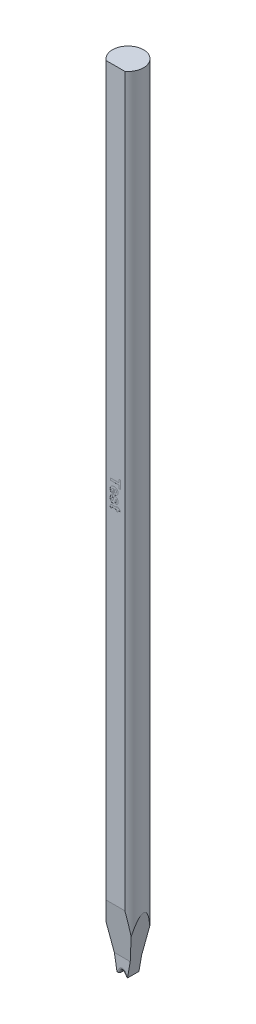
from build123d import *

# Parameters (mm, degrees)
SKETCH_TL_CUTTING_R       = 1.4986
TL_CUTTING_DEPTH          = 75.9968
SKETCH_TDF_GRINDING_W     = 3.0172
SKETCH_TDF_GRINDING_H     = 3.0172
TDF_GRINDING_DEPTH        = 77.026345527
ENGRAVING_DEPTH           = 0.005
VW_VR_GRINDING_DEPTH      = 1.5086
VW_VR_GRINDING_DEPTH_BACK = 1.5086
ISA_GRINDING_DEPTH        = 1.5086
ISA_GRINDING_DEPTH_BACK   = 1.5086
PRE_FRX_BRX_DEPTH         = 1.5086
PRE_FRX_BRX_DEPTH_BACK    = 1.5086
SKETCH_PRE_FRX_BRX_W      = 0.95742
SKETCH_PRE_FRX_BRX_H      = 1.4986
SKETCH_PRE_FRX_BRX_W_2    = 0.95996
FR_EDM_R                  = 0.24892
BR_EDM_R                  = 0.24892
FA_BA_GRINDING_DEPTH      = 1.5086
FA_BA_GRINDING_DEPTH_BACK = 1.5086


with BuildPart() as part:
    # sketch_TL_cutting → TL_cutting (new body)
    with BuildSketch(Plane(origin=(0, 0, 0), x_dir=(1, 0, 0), z_dir=(0, 1, 0))):
        Circle(SKETCH_TL_CUTTING_R)
    extrude(amount=TL_CUTTING_DEPTH)

    # sketch_TDF_grinding → TDF_grinding (cut, through all)
    with BuildSketch(Plane(origin=(0, 0, 0), x_dir=(1, 0, 0), z_dir=(0, 1, 0))):
        with Locations((0, -2.71002)):
            Rectangle(SKETCH_TDF_GRINDING_W, SKETCH_TDF_GRINDING_H)
    extrude(amount=TDF_GRINDING_DEPTH, mode=Mode.SUBTRACT)

    # sketch_engraving → engraving (cut)
    # profile 1 of 4: a face of its own
    with BuildSketch(Plane.XY.offset(1.20142)):
        Polygon((-0.5, 41.464906667), (0.333333333, 41.464906667), (0.333333333, 41.759778462), (0.5, 41.759778462), (0.5, 40.977727179), (0.333333333, 40.977727179), (0.333333333, 41.272598974), (-0.5, 41.272598974), align=None)
    # profile 2 of 4: a face of its own
    with BuildSketch(Plane.XY.offset(1.20142)):
        with BuildLine():
            Line((-0.269230769, 40.439265641), (-0.294871795, 40.246957949))
            add(Edge.make_bspline(
                [(-0.294871795, 40.246957949), (-0.303536255, 40.25010341), (-0.32057243, 40.256288057), (-0.344863965, 40.267587447), (-0.36753558, 40.280217941), (-0.38870841, 40.294118818), (-0.40841008, 40.309238344), (-0.426226149, 40.326076464), (-0.442819851, 40.343812903), (-0.457401048, 40.363189569), (-0.470514378, 40.383720953), (-0.481988402, 40.405510233), (-0.491332973, 40.428731665), (-0.499158418, 40.4530336), (-0.505404699, 40.478526347), (-0.509771463, 40.505313912), (-0.51242458, 40.533361927), (-0.512686872, 40.552507543), (-0.512820513, 40.562262436)],
                knots=[0, 0, 0, 0, 1.071172907, 2.106154283, 3.1104349, 4.085737425, 5.048416355, 5.993087888, 6.932482331, 7.868664062, 8.80754521, 9.762367971, 10.726735429, 11.713584758, 12.728370439, 13.774815933, 14.866245336, 16, 16, 16, 16], degree=3))
            add(Edge.make_bspline(
                [(-0.512820513, 40.562262436), (-0.512443282, 40.577505689), (-0.51171073, 40.607106927), (-0.505852845, 40.649939619), (-0.496231539, 40.689758957), (-0.482996444, 40.726630518), (-0.465262586, 40.760258048), (-0.443980436, 40.790893584), (-0.418772334, 40.818567377), (-0.399264925, 40.834082304), (-0.389423077, 40.841909872)],
                knots=[0, 0, 0, 0, 1.15090686, 2.234973544, 3.257507168, 4.240282073, 5.185422152, 6.119941203, 7.051475585, 8, 8, 8, 8], degree=3))
            add(Edge.make_bspline(
                [(-0.389423077, 40.841909872), (-0.381046549, 40.847684615), (-0.364178666, 40.859313262), (-0.336856894, 40.873798975), (-0.307933811, 40.886068192), (-0.277558503, 40.896316223), (-0.245440266, 40.904091085), (-0.211772448, 40.909713673), (-0.176408554, 40.912856462), (-0.152316287, 40.9133651), (-0.140024038, 40.913624615)],
                knots=[0, 0, 0, 0, 0.924739034, 1.862154457, 2.806332648, 3.78003102, 4.774289357, 5.808656063, 6.881942244, 8, 8, 8, 8], degree=3))
            add(Edge.make_bspline(
                [(-0.140024038, 40.913624615), (-0.125455951, 40.913382004), (-0.096984123, 40.912907846), (-0.055513373, 40.908444498), (-0.016425807, 40.901108358), (0.020119322, 40.890700859), (0.054294407, 40.87742375), (0.086062076, 40.86124031), (0.115338437, 40.841856538), (0.141890673, 40.819628649), (0.165678093, 40.795179773), (0.186654734, 40.769191172), (0.204171816, 40.741432799), (0.218793413, 40.712327282), (0.22973775, 40.681387916), (0.237794287, 40.649002574), (0.242700593, 40.615029484), (0.243290251, 40.591859286), (0.243589744, 40.580090962)],
                knots=[0, 0, 0, 0, 1.22208028, 2.38843015, 3.495001974, 4.555551, 5.572102979, 6.566928721, 7.541284444, 8.51191166, 9.466805643, 10.399597494, 11.308905182, 12.215983304, 13.126946664, 14.056451325, 15.012856426, 16, 16, 16, 16], degree=3))
            add(Edge.make_bspline(
                [(0.243589744, 40.580090962), (0.243311261, 40.566919824), (0.242766301, 40.541145288), (0.237650471, 40.503565991), (0.229328986, 40.468085107), (0.217373094, 40.434816508), (0.202375393, 40.40355058), (0.183809309, 40.37449302), (0.161721866, 40.34770694), (0.136526927, 40.322947507), (0.107657568, 40.301021168), (0.075306929, 40.282081461), (0.039386169, 40.266291438), (-6.4395e-05, 40.25346711), (-0.043155579, 40.243992551), (-0.089766999, 40.237507904), (-0.139896801, 40.233810273), (-0.174473137, 40.234026108), (-0.192307692, 40.234137436)],
                knots=[0, 0, 0, 0, 0.994914541, 1.946943474, 2.860007193, 3.744253739, 4.613162343, 5.475451996, 6.343187588, 7.231728884, 8.139057486, 9.075471918, 10.058180036, 11.098621179, 12.205332334, 13.387827392, 14.65263521, 16, 16, 16, 16], degree=3))
            Line((-0.192307692, 40.234137436), (-0.192307692, 40.721316923))
            add(Edge.make_bspline(
                [(-0.192307692, 40.721316923), (-0.199190121, 40.720999192), (-0.212592416, 40.720380467), (-0.232195578, 40.718086627), (-0.250479259, 40.713947909), (-0.267812634, 40.709078971), (-0.283741268, 40.70243089), (-0.298585088, 40.694544096), (-0.312263908, 40.685333492), (-0.324637591, 40.674722151), (-0.335614883, 40.66309259), (-0.345276708, 40.650829783), (-0.353640982, 40.6379697), (-0.360224098, 40.624195392), (-0.365494916, 40.609790027), (-0.36902659, 40.59464782), (-0.371322908, 40.578892139), (-0.371635397, 40.568146811), (-0.371794872, 40.562663077)],
                knots=[0, 0, 0, 0, 1.231638706, 2.398395625, 3.522289669, 4.579947828, 5.613000372, 6.600997726, 7.58103015, 8.554716894, 9.508889492, 10.435482506, 11.342805004, 12.245087657, 13.158904806, 14.079635201, 15.019967576, 16, 16, 16, 16], degree=3))
            add(Edge.make_bspline(
                [(-0.371794872, 40.562663077), (-0.37147122, 40.555363831), (-0.370844355, 40.541226282), (-0.366452232, 40.520847955), (-0.358712143, 40.502358041), (-0.34792154, 40.485562797), (-0.333591606, 40.470618375), (-0.315339539, 40.458089025), (-0.293735149, 40.447134255), (-0.277667648, 40.441974811), (-0.269230769, 40.439265641)],
                knots=[0, 0, 0, 0, 1.004430367, 1.945431754, 2.851730883, 3.749038912, 4.678525969, 5.68064125, 6.782128749, 8, 8, 8, 8], degree=3))
        make_face()
        with BuildLine():
            add(Edge.make_bspline(
                [(-0.076923077, 40.426445128), (-0.0698403, 40.426773639), (-0.056046098, 40.427413437), (-0.035946701, 40.429550056), (-0.017148581, 40.433043965), (0.000200148, 40.438199045), (0.016332408, 40.444147578), (0.031252693, 40.451307474), (0.044751188, 40.459955927), (0.056718236, 40.469898372), (0.067663617, 40.48037548), (0.076749299, 40.491967324), (0.084970517, 40.503707813), (0.091312261, 40.516239906), (0.09644632, 40.529225061), (0.100044461, 40.542799996), (0.102017666, 40.556996733), (0.102379943, 40.566596988), (0.102564103, 40.571477179)],
                knots=[0, 0, 0, 0, 1.317155349, 2.565252013, 3.752617023, 4.863710936, 5.923691592, 6.944619286, 7.932291025, 8.893346204, 9.832040666, 10.740742434, 11.625065814, 12.490654946, 13.343074709, 14.215747339, 15.092993572, 16, 16, 16, 16], degree=3))
            add(Edge.make_bspline(
                [(0.102564103, 40.571477179), (0.102394824, 40.576692132), (0.102061251, 40.586968456), (0.099884751, 40.602038379), (0.096024349, 40.616322459), (0.09079949, 40.629929555), (0.083918898, 40.642830507), (0.0754807, 40.655025603), (0.065590542, 40.666560723), (0.058097667, 40.673511161), (0.054286859, 40.67704609)],
                knots=[0, 0, 0, 0, 1.043516863, 2.056302107, 3.038302912, 3.998520634, 4.966791607, 5.956307719, 6.960596886, 8, 8, 8, 8], degree=3))
            add(Edge.make_bspline(
                [(0.054286859, 40.67704609), (0.050143389, 40.680339206), (0.04181864, 40.686955486), (0.028026538, 40.695376823), (0.013220128, 40.702598805), (-0.002752654, 40.708441047), (-0.019802657, 40.712817844), (-0.037911914, 40.715738646), (-0.057052364, 40.717597277), (-0.070174406, 40.717804764), (-0.076923077, 40.717911474)],
                knots=[0, 0, 0, 0, 0.903766344, 1.81577923, 2.754803886, 3.715080786, 4.716965023, 5.758108642, 6.846994466, 8, 8, 8, 8], degree=3))
            Line((-0.076923077, 40.717911474), (-0.076923077, 40.426445128))
        make_face(mode=Mode.SUBTRACT)
    # profile 3 of 4: a face of its own
    with BuildSketch(Plane.XY.offset(1.20142)):
        with BuildLine():
            Line((-0.282051282, 40.157214359), (-0.256410256, 39.964906667))
            add(Edge.make_bspline(
                [(-0.256410256, 39.964906667), (-0.265392316, 39.962598786), (-0.282694005, 39.958153233), (-0.306215409, 39.946892879), (-0.326584524, 39.932776729), (-0.343301626, 39.914989528), (-0.356462242, 39.89364559), (-0.365240358, 39.868427989), (-0.37099337, 39.839698413), (-0.37151826, 39.81923851), (-0.371794872, 39.808456346)],
                knots=[0, 0, 0, 0, 1.039319445, 2.001988807, 2.911187514, 3.807680854, 4.723381073, 5.705509029, 6.790826147, 8, 8, 8, 8], degree=3))
            add(Edge.make_bspline(
                [(-0.371794872, 39.808456346), (-0.371595476, 39.7966699), (-0.371221553, 39.774567061), (-0.365704055, 39.74385632), (-0.358276706, 39.717120835), (-0.349217718, 39.702405088), (-0.344951923, 39.695475577)],
                knots=[0, 0, 0, 0, 1.198484229, 2.247488828, 3.174758401, 4, 4, 4, 4], degree=3))
            add(Edge.make_bspline(
                [(-0.344951923, 39.695475577), (-0.341742613, 39.691522291), (-0.33550118, 39.683833982), (-0.322943507, 39.676031952), (-0.309159996, 39.670838698), (-0.299329041, 39.670307951), (-0.294270833, 39.670034872)],
                knots=[0, 0, 0, 0, 1.030872991, 2.004830756, 2.973448591, 4, 4, 4, 4], degree=3))
            add(Edge.make_bspline(
                [(-0.294270833, 39.670034872), (-0.29084777, 39.670165774), (-0.284161693, 39.670421458), (-0.274600311, 39.673096895), (-0.265958556, 39.677587368), (-0.261079044, 39.681752599), (-0.258613782, 39.683856987)],
                knots=[0, 0, 0, 0, 1.045349703, 2.041822997, 3.010676005, 4, 4, 4, 4], degree=3))
            add(Edge.make_bspline(
                [(-0.258613782, 39.683856987), (-0.256288912, 39.686922785), (-0.250848162, 39.694097485), (-0.244943535, 39.708429431), (-0.238900398, 39.726835958), (-0.235595409, 39.740712737), (-0.233774038, 39.748360192)],
                knots=[0, 0, 0, 0, 0.66039037, 1.545471194, 2.647315926, 4, 4, 4, 4], degree=3))
            add(Edge.make_bspline(
                [(-0.233774038, 39.748360192), (-0.229705714, 39.767006174), (-0.22194668, 39.802567449), (-0.209757361, 39.853068792), (-0.19774553, 39.898138274), (-0.186203797, 39.937925975), (-0.174918001, 39.972396417), (-0.163759522, 40.001503265), (-0.153049809, 40.025369784), (-0.144879526, 40.038819946), (-0.141225962, 40.044834551)],
                knots=[0, 0, 0, 0, 1.469060602, 2.801765397, 3.998694248, 5.05919304, 5.990566457, 6.789528243, 7.45870461, 8, 8, 8, 8], degree=3))
            add(Edge.make_bspline(
                [(-0.141225962, 40.044834551), (-0.136226873, 40.051692589), (-0.126466322, 40.065082676), (-0.109659896, 40.082918181), (-0.091386741, 40.098041367), (-0.071590355, 40.110406522), (-0.050318141, 40.119844447), (-0.027668833, 40.12674572), (-0.003546555, 40.130742085), (0.013006297, 40.131292888), (0.021434295, 40.131573333)],
                knots=[0, 0, 0, 0, 1.056974227, 2.063706289, 3.045111424, 4.005796011, 4.963194591, 5.937303459, 6.949763919, 8, 8, 8, 8], degree=3))
            add(Edge.make_bspline(
                [(0.021434295, 40.131573333), (0.029124721, 40.131328093), (0.04431443, 40.130843707), (0.06658025, 40.127437557), (0.08788195, 40.121558829), (0.108244702, 40.113277356), (0.127669101, 40.102661186), (0.146109736, 40.089645985), (0.163499189, 40.07434958), (0.18008332, 40.056885441), (0.195101302, 40.036850205), (0.208193344, 40.014188789), (0.219189739, 39.988972252), (0.228160641, 39.961181932), (0.235116926, 39.930812892), (0.240034197, 39.897864691), (0.243059894, 39.862399271), (0.243409494, 39.837909752), (0.243589744, 39.825283269)],
                knots=[0, 0, 0, 0, 0.866628782, 1.711717909, 2.531497577, 3.35182975, 4.18367977, 5.02092497, 5.890294189, 6.790012725, 7.730721042, 8.705258537, 9.733001209, 10.825364086, 11.991866675, 13.2403337, 14.577151382, 16, 16, 16, 16], degree=3))
            add(Edge.make_bspline(
                [(0.243589744, 39.825283269), (0.243446899, 39.813259386), (0.243169634, 39.789920784), (0.240731219, 39.756155029), (0.236899188, 39.724737838), (0.230948561, 39.695813753), (0.223974046, 39.669047243), (0.214898634, 39.644830721), (0.204526083, 39.622833073), (0.19215876, 39.603347891), (0.178364946, 39.585602816), (0.162861914, 39.569633528), (0.145977964, 39.554950901), (0.127601745, 39.541585817), (0.107595464, 39.529812221), (0.085933763, 39.519636763), (0.062896123, 39.510489482), (0.046718542, 39.505774647), (0.038461538, 39.503368205)],
                knots=[0, 0, 0, 0, 1.38031105, 2.679211982, 3.884975083, 5.011116117, 6.067453267, 7.057174624, 7.976132094, 8.854607518, 9.701157373, 10.55241532, 11.405604341, 12.267429654, 13.157569633, 14.066300783, 15.01304394, 16, 16, 16, 16], degree=3))
            Line((0.038461538, 39.503368205), (0.012820513, 39.695675897))
            add(Edge.make_bspline(
                [(0.012820513, 39.695675897), (0.019716836, 39.697580158), (0.033104434, 39.701276834), (0.051141649, 39.710461289), (0.066892754, 39.721619959), (0.079947134, 39.735527254), (0.090451531, 39.752318536), (0.097449696, 39.772358362), (0.101956518, 39.795301397), (0.102353946, 39.811637086), (0.102564103, 39.820275256)],
                knots=[0, 0, 0, 0, 1.018112573, 1.976427386, 2.86989064, 3.759232895, 4.678909429, 5.673224298, 6.76962116, 8, 8, 8, 8], degree=3))
            add(Edge.make_bspline(
                [(0.102564103, 39.820275256), (0.102424935, 39.830982738), (0.102166286, 39.850883004), (0.098045863, 39.878167454), (0.092323932, 39.901157567), (0.085068416, 39.913538276), (0.081730769, 39.91923359)],
                knots=[0, 0, 0, 0, 1.252081424, 2.327041614, 3.230413832, 4, 4, 4, 4], degree=3))
            add(Edge.make_bspline(
                [(0.081730769, 39.91923359), (0.079197183, 39.922315647), (0.074335374, 39.92822994), (0.064913663, 39.934615197), (0.054472552, 39.938670868), (0.047046059, 39.939065133), (0.043269231, 39.939265641)],
                knots=[0, 0, 0, 0, 1.057832138, 2.029920023, 2.998093444, 4, 4, 4, 4], degree=3))
            add(Edge.make_bspline(
                [(0.043269231, 39.939265641), (0.040033897, 39.939021951), (0.033581253, 39.938535928), (0.024317894, 39.934949065), (0.015848023, 39.928959869), (0.011363278, 39.923496983), (0.009014423, 39.920635833)],
                knots=[0, 0, 0, 0, 0.958252903, 1.911167308, 2.905987877, 4, 4, 4, 4], degree=3))
            add(Edge.make_bspline(
                [(0.009014423, 39.920635833), (0.007272068, 39.917937565), (0.003109312, 39.911490986), (-0.001987057, 39.899028151), (-0.007675168, 39.882869504), (-0.014111167, 39.86289725), (-0.021107365, 39.839067407), (-0.028443749, 39.811261341), (-0.036209836, 39.779579843), (-0.044306367, 39.745132427), (-0.052630208, 39.710146792), (-0.061887965, 39.676931001), (-0.071549097, 39.646529038), (-0.082070854, 39.618979873), (-0.092726589, 39.594156602), (-0.103967718, 39.572171411), (-0.115635077, 39.552916043), (-0.124552329, 39.541748363), (-0.12880609, 39.53642109)],
                knots=[0, 0, 0, 0, 0.374467347, 0.894660112, 1.565561736, 2.376893081, 3.344161852, 4.465830414, 5.734896654, 7.153471884, 8.598442955, 9.934182422, 11.179548312, 12.322244199, 13.376910086, 14.332509539, 15.204563813, 16, 16, 16, 16], degree=3))
            add(Edge.make_bspline(
                [(-0.12880609, 39.53642109), (-0.133161207, 39.531687939), (-0.141766598, 39.522335582), (-0.156708359, 39.510557826), (-0.172517892, 39.500117029), (-0.189865737, 39.492033237), (-0.208297358, 39.485514129), (-0.22803715, 39.480894372), (-0.249067342, 39.478389915), (-0.263482048, 39.477951013), (-0.270833333, 39.477727179)],
                knots=[0, 0, 0, 0, 0.971012965, 1.9186502, 2.868006896, 3.82989672, 4.803792202, 5.820095146, 6.888280979, 8, 8, 8, 8], degree=3))
            add(Edge.make_bspline(
                [(-0.270833333, 39.477727179), (-0.278992426, 39.478025435), (-0.295065709, 39.478612994), (-0.31877832, 39.482420371), (-0.34148056, 39.48919885), (-0.363516332, 39.498118098), (-0.384457432, 39.510155706), (-0.404505714, 39.524688777), (-0.423895683, 39.541581114), (-0.442088641, 39.561200642), (-0.458702848, 39.583469566), (-0.473419718, 39.608176937), (-0.485630501, 39.635506147), (-0.495629007, 39.665301312), (-0.503343888, 39.697625073), (-0.50897222, 39.7324343), (-0.51206406, 39.769738424), (-0.512563429, 39.795430104), (-0.512820513, 39.808656667)],
                knots=[0, 0, 0, 0, 0.853005228, 1.680406763, 2.502135431, 3.325285981, 4.159928718, 5.020072903, 5.910500533, 6.844018396, 7.811498054, 8.809909951, 9.84399402, 10.934451331, 12.090792638, 13.314110396, 14.617253208, 16, 16, 16, 16], degree=3))
            add(Edge.make_bspline(
                [(-0.512820513, 39.808656667), (-0.512612848, 39.82074682), (-0.51220841, 39.84429301), (-0.509517578, 39.878649126), (-0.504407099, 39.911008929), (-0.497724819, 39.941430888), (-0.489040825, 39.969973279), (-0.478560901, 39.996595401), (-0.465826863, 40.021265098), (-0.451129931, 40.04390131), (-0.434940139, 40.064778229), (-0.417179349, 40.083690578), (-0.398157879, 40.100828513), (-0.377590042, 40.115822075), (-0.355813358, 40.129219627), (-0.332587631, 40.140558496), (-0.307935086, 40.150141386), (-0.290780182, 40.154829112), (-0.282051282, 40.157214359)],
                knots=[0, 0, 0, 0, 1.27602789, 2.485129288, 3.633323873, 4.730967468, 5.769800648, 6.778755409, 7.74637841, 8.694428407, 9.62340196, 10.530821678, 11.429165597, 12.321379864, 13.213343615, 14.124177522, 15.045528489, 16, 16, 16, 16], degree=3))
        make_face()
    # profile 4 of 4: a face of its own
    with BuildSketch(Plane.XY.offset(1.20142)):
        with BuildLine():
            Line((0.230769231, 38.964906667), (0.08974359, 38.964906667))
            Line((0.08974359, 38.964906667), (0.08974359, 39.105932308))
            Line((0.08974359, 39.105932308), (-0.224358974, 39.105932308))
            add(Edge.make_bspline(
                [(-0.224358974, 39.105932308), (-0.231904339, 39.105945556), (-0.246127351, 39.10597053), (-0.266228543, 39.105806237), (-0.283853768, 39.105325979), (-0.299018236, 39.105043629), (-0.311701045, 39.104364066), (-0.321861303, 39.103856773), (-0.329566697, 39.103134169), (-0.338907815, 39.101406455), (-0.35057578, 39.096378956), (-0.360389431, 39.086711483), (-0.366182432, 39.077189126), (-0.369474906, 39.069160251), (-0.371514578, 39.060361013), (-0.371700117, 39.05419399), (-0.371794872, 39.051044487)],
                knots=[0, 0, 0, 0, 1.773599637, 3.343235314, 4.724802322, 5.918078765, 6.908020279, 7.709878159, 8.309605123, 8.725167438, 9.94114383, 11.228754835, 11.890951744, 12.552590386, 13.260806876, 14, 14, 14, 14], degree=3))
            add(Edge.make_bspline(
                [(-0.371794872, 39.051044487), (-0.371507964, 39.045889495), (-0.37087716, 39.034555574), (-0.367095421, 39.016080849), (-0.361305779, 38.994622787), (-0.356131124, 38.979434648), (-0.353365385, 38.971316923)],
                knots=[0, 0, 0, 0, 0.75345353, 1.656565626, 2.747486109, 4, 4, 4, 4], degree=3))
            Line((-0.353365385, 38.971316923), (-0.487379808, 38.952086154))
            add(Edge.make_bspline(
                [(-0.487379808, 38.952086154), (-0.491390152, 38.963763487), (-0.499569528, 38.98758022), (-0.506906498, 39.025434946), (-0.512003384, 39.065327386), (-0.512543433, 39.092693162), (-0.512820513, 39.10673359)],
                knots=[0, 0, 0, 0, 0.939563481, 1.916305015, 2.930928536, 4, 4, 4, 4], degree=3))
            add(Edge.make_bspline(
                [(-0.512820513, 39.10673359), (-0.512564303, 39.115356227), (-0.512063975, 39.132194556), (-0.50889268, 39.156851395), (-0.50326966, 39.180140275), (-0.495519476, 39.201893835), (-0.485995694, 39.221539445), (-0.475305475, 39.238842282), (-0.462868601, 39.253035517), (-0.449141562, 39.264891308), (-0.433202705, 39.274242612), (-0.415065056, 39.281666561), (-0.394648734, 39.288046812), (-0.380046946, 39.290660521), (-0.372395833, 39.292030064)],
                knots=[0, 0, 0, 0, 1.203015215, 2.349253984, 3.460901624, 4.539344044, 5.564274864, 6.502382232, 7.367332183, 8.186789841, 9.022345106, 9.932420497, 10.916620053, 12, 12, 12, 12], degree=3))
            add(Edge.make_bspline(
                [(-0.372395833, 39.292030064), (-0.369192653, 39.292510274), (-0.362066116, 39.293578659), (-0.35025766, 39.295028229), (-0.336212257, 39.295922671), (-0.319980191, 39.296655635), (-0.301558032, 39.297595843), (-0.280981809, 39.297794627), (-0.258215711, 39.298369957), (-0.242321525, 39.298284749), (-0.233974359, 39.29824)],
                knots=[0, 0, 0, 0, 0.560521704, 1.24706641, 2.057998689, 2.995119087, 4.059211621, 5.249632546, 6.555586685, 8, 8, 8, 8], degree=3))
            Line((-0.233974359, 39.29824), (0.08974359, 39.29824))
            Line((0.08974359, 39.29824), (0.08974359, 39.38798359))
            Line((0.08974359, 39.38798359), (0.230769231, 39.38798359))
            Line((0.230769231, 39.38798359), (0.230769231, 39.29824))
            Line((0.230769231, 39.29824), (0.371794872, 39.29824))
            Line((0.371794872, 39.29824), (0.487179487, 39.105932308))
            Line((0.487179487, 39.105932308), (0.230769231, 39.105932308))
            Line((0.230769231, 39.105932308), (0.230769231, 38.964906667))
        make_face()
    extrude(amount=-ENGRAVING_DEPTH, mode=Mode.SUBTRACT)

    # sketch_VW_VR_grinding → VW_VR_grinding (cut, two sides: drawn at the far end of the back side and taken through both)
    with BuildSketch(Plane.XY.offset(-VW_VR_GRINDING_DEPTH_BACK)):
        with BuildLine():
            Line((-1.4936, -0.01), (-1.4936, 1.4836))
            ThreePointArc((-1.4936, 1.4836), (-1.495064466, 1.487135534), (-1.4986, 1.4886))
            Line((-1.4986, 1.4886), (-1.5086, 1.4886))
            Line((-1.5086, 1.4886), (-1.5086, -0.01))
            Line((-1.5086, -0.01), (-1.4936, -0.01))
        make_face()
        with BuildLine():
            Line((1.4936, -0.01), (1.4936, 1.4836))
            ThreePointArc((1.4936, 1.4836), (1.495064466, 1.487135534), (1.4986, 1.4886))
            Line((1.4986, 1.4886), (1.5086, 1.4886))
            Line((1.5086, 1.4886), (1.5086, -0.01))
            Line((1.5086, -0.01), (1.4936, -0.01))
        make_face()
    extrude(amount=VW_VR_GRINDING_DEPTH + VW_VR_GRINDING_DEPTH_BACK, mode=Mode.SUBTRACT)

    # sketch_ISA_grinding → ISA_grinding (cut, two sides: drawn at the far end of the back side and taken through both)
    with BuildSketch(Plane.XY.offset(-ISA_GRINDING_DEPTH_BACK)):
        Polygon((-0.50038, 0), (-1.5086, 5.717899756), (-1.5086, -0.01), (1.5086, -0.01), (1.5086, 5.717899756), (0.50038, 0), align=None)
    extrude(amount=ISA_GRINDING_DEPTH + ISA_GRINDING_DEPTH_BACK, mode=Mode.SUBTRACT)

    # sketch_pre_FRX_BRX → pre_FRX_BRX (cut, two sides: drawn at the far end of the back side and taken through both)
    with BuildSketch(Plane(origin=(0, 0, 0), x_dir=(0, 0, -1), z_dir=(1, 0, 0)).offset(-PRE_FRX_BRX_DEPTH_BACK)):
        with Locations((-1.02989, 0.7393)):
            Rectangle(SKETCH_PRE_FRX_BRX_W, SKETCH_PRE_FRX_BRX_H)
        with Locations((1.02862, 0.7393)):
            Rectangle(SKETCH_PRE_FRX_BRX_W_2, SKETCH_PRE_FRX_BRX_H)
    extrude(amount=PRE_FRX_BRX_DEPTH + PRE_FRX_BRX_DEPTH_BACK, mode=Mode.SUBTRACT)

    # V-Groove_EDM: sweep along a path in sketch_contour_V-Groove
    with BuildLine(Plane(origin=(0, 0, 0), x_dir=(0, 0, -1), z_dir=(1, 0, 0))) as v_groove_edm_path:
        Line((-1.20142, 0.32004), (-0.00127, 0.32004))
        Line((-0.00127, 0.32004), (1.4986, 0.32004))
    # sketch_section_V-Groove → V-Groove_EDM (sweep, cut)
    with BuildSketch(Plane.XY.offset(1.20142)):
        with BuildLine():
            Line((-2.516534205, -3.2004), (-0.08103223, 0.277857291))
            ThreePointArc((-0.08103223, 0.277857291), (0, 0.32004), (0.08103223, 0.277857291))
            Line((0.08103223, 0.277857291), (2.516534205, -3.2004))
            Line((2.516534205, -3.2004), (-2.516534205, -3.2004))
        make_face()
    sweep(path=v_groove_edm_path.line, mode=Mode.SUBTRACT)

    # FR_EDM
    fr_edm_edges = [part.edges().sort_by_distance(p)[0] for p in [
        (0.178311115, 0.138928645, 0.55118),
        (0, 0.32004, 0.55118),
        (-0.178311115, 0.138928645, 0.55118),
    ]]
    fillet(fr_edm_edges, radius=FR_EDM_R)

    # BR_EDM
    br_edm_edges = [part.edges().sort_by_distance(p)[0] for p in [
        (0.178311115, 0.138928645, -0.54864),
        (0, 0.32004, -0.54864),
        (-0.178311115, 0.138928645, -0.54864),
    ]]
    fillet(br_edm_edges, radius=BR_EDM_R)

    # sketch_FA_BA_grinding → FA_BA_grinding (cut, two sides: drawn at the far end of the back side and taken through both)
    with BuildSketch(Plane(origin=(0, 0, 0), x_dir=(0, 0, -1), z_dir=(1, 0, 0)).offset(-FA_BA_GRINDING_DEPTH_BACK)):
        Polygon((2.4986, 15.373286344), (2.4986, -0.1), (0.54864, -0.1), (0.54864, 1.4986), align=None)
        Polygon((-3.498888656, 22.472636919), (-0.55118, 1.4986), (-0.55118, -0.1), (-3.498888656, -0.1), align=None)
    extrude(amount=FA_BA_GRINDING_DEPTH + FA_BA_GRINDING_DEPTH_BACK, mode=Mode.SUBTRACT)


solid = part.part
